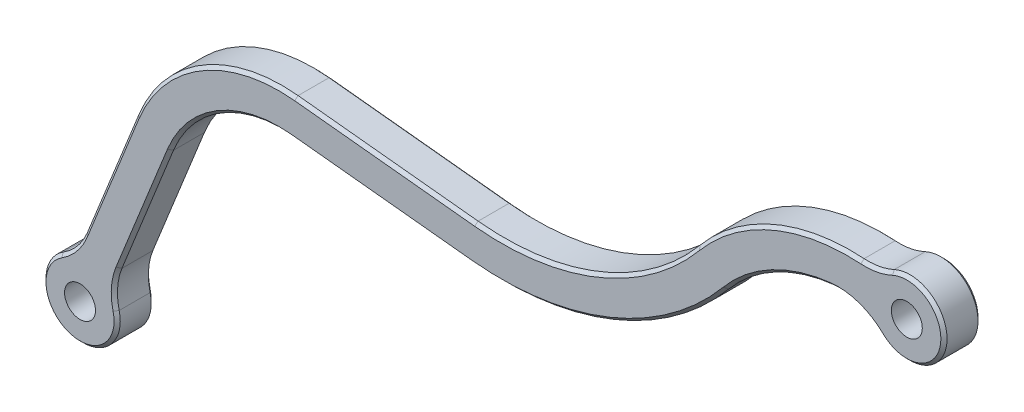
from build123d import *

# Parameters (mm, degrees)
EXTRUDE_THIN1_DEPTH   = 3
SKETCH1_3_R           = 3
BOSS_EXTRUDE1_DEPTH   = 3
FILLET1_R             = 5
F_2_5MM_DOWEL_HOLE1_D = 2.5
CHAMFER1_SIZE         = 0.25


with BuildPart() as part:
    # Sketch1 → Extrude-Thin1 (new body)
    with BuildSketch(Plane.XY):
        with BuildLine():
            ThreePointArc((67.932775445, 34.102173105), (58.457726976, 34.411419672), (50.491619232, 29.272032126))
            ThreePointArc((50.491619232, 29.272032126), (42.436789288, 23.388051771), (32.560988498, 21.984460302))
            Line((32.560988498, 21.984460302), (18.0194176, 23.497567077))
            ThreePointArc((18.0194176, 23.497567077), (10.297542455, 21.776854665), (5.1667157, 15.754992513))
            Line((5.1667157, 15.754992513), (-0.737799909, 1.088733357))
            Line((-0.737799909, 1.088733357), (2.04513605, -0.031653828))
            Line((2.04513605, -0.031653828), (7.949651659, 14.634605328))
            ThreePointArc((7.949651659, 14.634605328), (11.845577871, 19.207110251), (17.7089323, 20.513677186))
            Line((17.7089323, 20.513677186), (32.250503198, 19.000570412))
            ThreePointArc((32.250503198, 19.000570412), (43.566353212, 20.608827896), (52.795705795, 27.350786407))
            ThreePointArc((52.795705795, 27.350786407), (59.258407694, 31.520241644), (66.94527507, 31.269357719))
            Line((66.94527507, 31.269357719), (67.932775445, 34.102173105))
        make_face()
    extrude(amount=EXTRUDE_THIN1_DEPTH)

    # Sketch1<3> → Boss-Extrude1 (add, through all)
    with BuildSketch(Plane.XY):
        with Locations((0.653668071, 0.528539764)):
            Circle(SKETCH1_3_R)
        with Locations((67.439025258, 32.685765412)):
            Circle(SKETCH1_3_R)
    extrude(amount=BOSS_EXTRUDE1_DEPTH)

    # Fillet1
    fillet1_edges = [part.edges().sort_by_distance(p)[0] for p in [
        (0.232483855, 3.498826595, 1.5),
        (3.015419815, 2.37843941, 1.5),
        (64.556717413, 31.853718847, 1.5),
        (65.287195047, 34.77613063, 1.5),
    ]]
    fillet(fillet1_edges, radius=FILLET1_R)

    # Ø2.5mm Dowel Hole1 (through all)
    with Locations(Plane.XY.offset(3)):
        with Locations((67.439025258, 32.685765412), (0.653668071, 0.528539764)):
            Hole(F_2_5MM_DOWEL_HOLE1_D / 2)

    # Chamfer1
    chamfer1_edges = [part.edges().sort_by_distance(p)[0] for p in [
        (10.297542455, 21.776854665, 0),
        (25.290203049, 22.741013689, 0),
        (42.436789288, 23.388051771, 0),
        (43.566353212, 20.608827896, 0),
        (24.979717749, 19.757123799, 0),
        (5.868250185, 9.464600631, 3),
        (11.845577871, 19.207110251, 0),
        (5.868250185, 9.464600631, 0),
        (3.085314225, 10.584987816, 0),
        (11.845577871, 19.207110251, 3),
        (24.979717749, 19.757123799, 3),
        (43.566353212, 20.608827896, 3),
        (42.436789288, 23.388051771, 3),
        (25.290203049, 22.741013689, 3),
        (10.297542455, 21.776854665, 3),
        (3.085314225, 10.584987816, 3),
        (56.623528898, 30.466570313, 0),
        (56.623528898, 30.466570313, 3),
        (70.396803241, 32.184218401, 0),
        (70.396803241, 32.184218401, 3),
        (56.436616897, 33.701943285, 0),
        (56.436616897, 33.701943285, 3),
        (-0.466719115, -2.254396195, 3),
        (-0.466719115, -2.254396195, 0),
        (63.499669001, 31.670454016, 3),
        (63.499669001, 31.670454016, 0),
        (64.988861472, 35.027622491, 3),
        (64.988861472, 35.027622491, 0),
        (3.437869945, 2.784750939, 0),
        (3.437869945, 2.784750939, 3),
        (0.209401135, 4.084505995, 0),
        (0.209401135, 4.084505995, 3),
    ]]
    chamfer(chamfer1_edges, length=CHAMFER1_SIZE - 0.0001)  # a hair under: the kernel refuses the full size


solid = part.part
